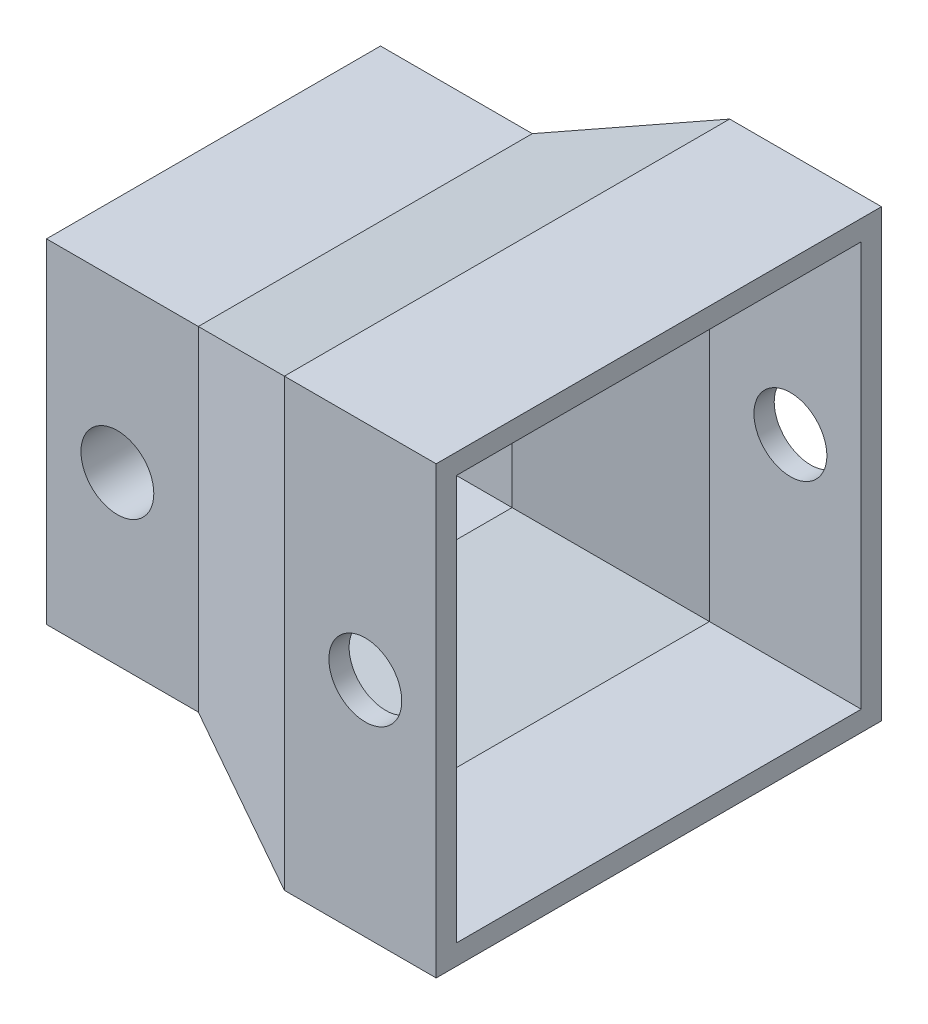
from build123d import *

# Parameters (mm, degrees)
SKETCH_1_R               = 2.5
EXTRUDE_1_DEPTH          = 1.5
SKETCH_2_R               = 3.5
EXTRUDE_2_DEPTH          = 1
SKETCH_3_R               = 2.5
EXTRUDE_3_DEPTH          = 2.5
SKETCH_4_R               = 3.5
EXTRUDE_4_DEPTH          = 1
SKETCH_5_R               = 2.5
EXTRUDE_5_DEPTH          = 2.5
SKETCH_6_R               = 3.5
EXTRUDE_6_DEPTH          = 1
SKETCH_7_R               = 2.5
EXTRUDE_7_DEPTH          = 2.5
SKETCH_10_R              = 3.5
EXTRUDE_9_DEPTH          = 1
SKETCH_11_R              = 2.5
EXTRUDE_10_DEPTH         = 1.5
SKETCH_12_R              = 1.8
CUT_EXTRUDE_2_DEPTH      = 16.321553446
EXTRUDE_11_DEPTH         = 3.5
EXTRUDE_11_DEPTH_BACK    = 4
SKETCH_13_W              = 22
SKETCH_13_H              = 22
SKETCH_13_W_2            = 20
SKETCH_13_H_2            = 20
EXTRUDE_12_DEPTH         = 4
EXTRUDE_12_DEPTH_BACK    = 3.5
SKETCH_14_W              = 16.5
SKETCH_14_H              = 16.5
SKETCH_14_W_2            = 14.5
SKETCH_14_H_2            = 14.5
PATTERN_CIRCULAR_1_COUNT = 4
SKETCH_19_R              = 1.8
CUT_EXTRUDE_3_DEPTH      = 29.875811782
SKETCH_20_R              = 1.8
CUT_EXTRUDE_4_DEPTH      = 31.7774269


with BuildPart() as part:
    # ｽｹｯﾁ1 → ﾎﾞｽ - 押し出し1 (new body)
    with BuildSketch(Plane.XY):
        Circle(SKETCH_1_R)
    extrude(amount=EXTRUDE_1_DEPTH)

    # ｽｹｯﾁ2 → ﾎﾞｽ - 押し出し2 (add)
    with BuildSketch(Plane.XY.offset(1.5)):
        Circle(SKETCH_2_R)
    extrude(amount=EXTRUDE_2_DEPTH)

    # ｽｹｯﾁ3 → ﾎﾞｽ - 押し出し3 (add)
    with BuildSketch(Plane.XY.offset(2.5)):
        Circle(SKETCH_3_R)
    extrude(amount=EXTRUDE_3_DEPTH)

    # ｽｹｯﾁ4 → ﾎﾞｽ - 押し出し4 (add)
    with BuildSketch(Plane.XY.offset(5)):
        Circle(SKETCH_4_R)
    extrude(amount=EXTRUDE_4_DEPTH)

    # ｽｹｯﾁ5 → ﾎﾞｽ - 押し出し5 (add)
    with BuildSketch(Plane.XY.offset(6)):
        Circle(SKETCH_5_R)
    extrude(amount=EXTRUDE_5_DEPTH)

    # ｽｹｯﾁ6 → ﾎﾞｽ - 押し出し6 (add)
    with BuildSketch(Plane.XY.offset(8.5)):
        Circle(SKETCH_6_R)
    extrude(amount=EXTRUDE_6_DEPTH)

    # ｽｹｯﾁ7 → ﾎﾞｽ - 押し出し7 (add)
    with BuildSketch(Plane.XY.offset(9.5)):
        Circle(SKETCH_7_R)
    extrude(amount=EXTRUDE_7_DEPTH)

    # ｽｹｯﾁ10 → ﾎﾞｽ - 押し出し9 (add)
    with BuildSketch(Plane.XY.offset(12)):
        Circle(SKETCH_10_R)
    extrude(amount=EXTRUDE_9_DEPTH)

    # ｽｹｯﾁ11 → ﾎﾞｽ - 押し出し10 (add)
    with BuildSketch(Plane.XY.offset(13)):
        Circle(SKETCH_11_R)
    extrude(amount=EXTRUDE_10_DEPTH)

    # ｽｹｯﾁ12 → ｶｯﾄ - 押し出し2 (cut, through all)
    with BuildSketch(Plane.XY.offset(14.5)):
        Circle(SKETCH_12_R)
    extrude(amount=-CUT_EXTRUDE_2_DEPTH, mode=Mode.SUBTRACT)

    # ｽｹｯﾁ14 → ﾎﾞｽ - 押し出し12 (add, two sides: drawn at the far end of the back side and taken through both)
    with BuildSketch(Plane(origin=(0, 0, 0), x_dir=(0, 0, -1), z_dir=(1, 0, 0)).offset(-EXTRUDE_12_DEPTH_BACK)):
        with Locations((-7.25, 0)):
            Rectangle(SKETCH_14_W, SKETCH_14_H)
        with Locations((-7.25, 0)):
            Rectangle(SKETCH_14_W_2, SKETCH_14_H_2, mode=Mode.SUBTRACT)
    extrude(amount=EXTRUDE_12_DEPTH + EXTRUDE_12_DEPTH_BACK)



with BuildPart() as body_2:
    # ｽｹｯﾁ13 → ﾎﾞｽ - 押し出し11 (new, two sides: drawn at the far end of the back side and taken through both)
    with BuildSketch(Plane(origin=(15, 0, 0), x_dir=(0, 0, -1), z_dir=(1, 0, 0)).offset(-EXTRUDE_11_DEPTH_BACK)):
        with Locations((-7.25, 0)):
            Rectangle(SKETCH_13_W, SKETCH_13_H)
        with Locations((-7.25, 0)):
            Rectangle(SKETCH_13_W_2, SKETCH_13_H_2, mode=Mode.SUBTRACT)
    extrude(amount=EXTRUDE_11_DEPTH + EXTRUDE_11_DEPTH_BACK)


with BuildPart() as part_1:
    add(part.part)

    add(body_2.part)  # ﾛﾌﾄ2 merges body 2
    # ｽｹｯﾁ16 → ﾛﾌﾄ2 section 0
    with BuildSketch(Plane.ZY.offset(-11)):
        with BuildLine():
            Line((-3.75, 11), (-2.75, 10))
            Line((-2.75, 10), (17.25, 10))
            Line((17.25, 10), (18.25, 11))
            Line((18.25, 11), (-3.75, 11))
        make_face()
    # ｽｹｯﾁ17 → ﾛﾌﾄ2 section 1
    with BuildSketch(Plane(origin=(4, 0, 0), x_dir=(0, 0, -1), z_dir=(1, 0, 0))):
        with BuildLine():
            Line((-15.5, 8.25), (-14.5, 7.25))
            Line((-14.5, 7.25), (0, 7.25))
            Line((0, 7.25), (1, 8.25))
            Line((1, 8.25), (-15.5, 8.25))
        make_face()
    loft_2 = loft()

    # 円形ﾊﾟﾀｰﾝ1: ﾛﾌﾄ2 ×4 about axis
    pattern_circular_1_axis = Axis((0.25, 0, 7.25), (-1, 0, 0))
    for i in range(1, PATTERN_CIRCULAR_1_COUNT):
        add(loft_2.rotate(pattern_circular_1_axis, i * 360 / PATTERN_CIRCULAR_1_COUNT))

    # ｽｹｯﾁ19 → ｶｯﾄ - 押し出し3 (cut, through all)
    with BuildSketch(Plane.XY.offset(15.5)):
        Circle(SKETCH_19_R)
    extrude(amount=-CUT_EXTRUDE_3_DEPTH, mode=Mode.SUBTRACT)

    # ｽｹｯﾁ20 → ｶｯﾄ - 押し出し4 (cut, through all)
    with BuildSketch(Plane.XY.offset(18.25)):
        with Locations((15, 0)):
            Circle(SKETCH_20_R)
    extrude(amount=-CUT_EXTRUDE_4_DEPTH, mode=Mode.SUBTRACT)


solid = part_1.part
